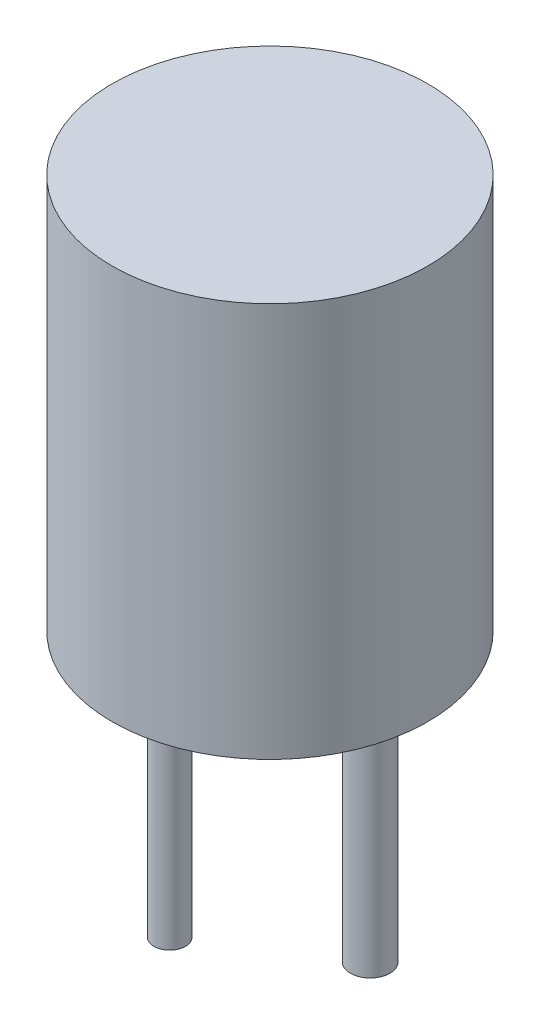
from build123d import *

# Parameters (mm, degrees)
SKETCH_1_R      = 4
EXTRUDE_1_DEPTH = 10
SKETCH_2_R      = 0.4
EXTRUDE_2_DEPTH = 8
SKETCH_3_R      = 0.5
EXTRUDE_3_DEPTH = 6


with BuildPart() as part:
    # 草图1 → 拉伸1 (new body)
    with BuildSketch(Plane(origin=(0, 0, 0), x_dir=(1, 0, 0), z_dir=(0, 1, 0))):
        Circle(SKETCH_1_R)
    extrude(amount=EXTRUDE_1_DEPTH)

    # 草图2 → 拉伸2 (add)
    with BuildSketch(Plane.XZ):
        with Locations((-2.54, 0)):
            Circle(SKETCH_2_R)
    extrude(amount=EXTRUDE_2_DEPTH)

    # 草图3 → 拉伸3 (add)
    with BuildSketch(Plane.XZ):
        with Locations((2.54, 0)):
            Circle(SKETCH_3_R)
    extrude(amount=EXTRUDE_3_DEPTH)


solid = part.part
